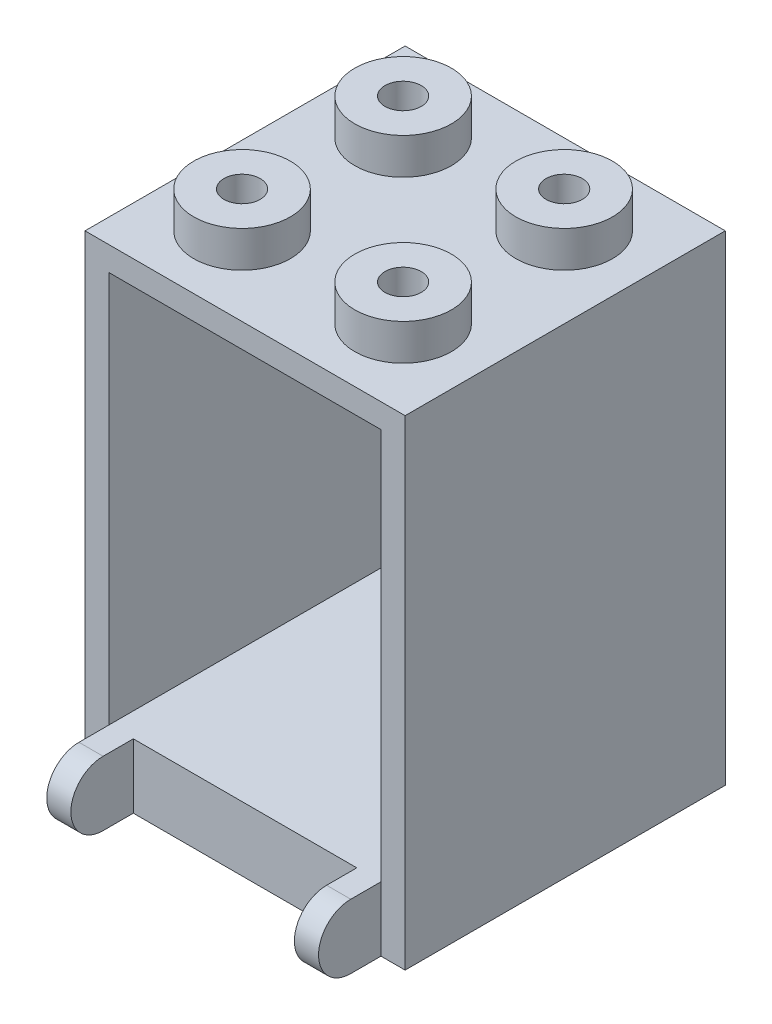
from build123d import *

# Parameters (mm, degrees)
SKETCH1_W            = 15.9
SKETCH1_H            = 23.85
BOSS_EXTRUDE1_DEPTH  = 15.9
SHELL2_T             = -1.2
SKETCH7_W            = 13.5
SKETCH7_H            = 14.7
BOSS_EXTRUDE4_DEPTH  = 2
SHELL3_START         = -6.75
SHELL3_OUTLINE_W     = 2
SHELL3_OUTLINE_H     = 13.5
SHELL3_DEPTH         = 13.5
BOSS_EXTRUDE3_DEPTH  = 1.2
SKETCH8_W            = 8.5
SKETCH8_H            = 2.8
CUT_EXTRUDE2_DEPTH   = 23.852748741
SKETCH9_W            = 0.5
SKETCH9_H            = 1.4
BOSS_EXTRUDE5_DEPTH  = 12.7
SKETCH10_R           = 3.25
SKETCH10_R_2         = 2.4
BOSS_EXTRUDE6_DEPTH  = 2
SKETCH11_R           = 2.4
SKETCH11_R_2         = 0.9
BOSS_EXTRUDE7_DEPTH  = 1.8
LPATTERN1_COUNT      = 2
LPATTERN1_PITCH      = 8
LPATTERN1_COUNT_DIR2 = 2
LPATTERN1_PITCH_DIR2 = 8


# Read off the part's stored shape, not the designer's step: Shell3
with BuildPart() as part:
    # Sketch1 → Boss-Extrude1 (new body)
    with BuildSketch(Plane.XY):
        Rectangle(SKETCH1_W, SKETCH1_H)
    extrude(amount=-BOSS_EXTRUDE1_DEPTH)

    # Shell2
    shell2_openings = [part.faces().sort_by_distance(p)[0] for p in [
        (0, 0, 0),
    ]]
    offset(amount=SHELL2_T, openings=shell2_openings, kind=Kind.INTERSECTION)

    # Sketch7 → Boss-Extrude4 (add)
    with BuildSketch(Plane(origin=(0, -10.725, 0), x_dir=(1, 0, 0), z_dir=(0, 1, 0))):
        with Locations((0, 7.35)):
            Rectangle(SKETCH7_W, SKETCH7_H)
    extrude(amount=BOSS_EXTRUDE4_DEPTH)

    # Shell3 outline → Shell3 (cut)
    with BuildSketch(Plane.YZ.offset(SHELL3_START)):
        with Locations((-10.925, -7.95)):
            Rectangle(SHELL3_OUTLINE_W, SHELL3_OUTLINE_H)
    extrude(amount=SHELL3_DEPTH, mode=Mode.SUBTRACT)

    # Sketch5 → Boss-Extrude3 (add)
    with BuildSketch(Plane(origin=(6.75, 0, 0), x_dir=(0, 0, -1), z_dir=(1, 0, 0))):
        with BuildLine():
            Line((0, -11.925), (-1.5, -11.925))
            ThreePointArc((-1.5, -11.925), (-3.1, -10.325), (-1.5, -8.725))
            Line((-1.5, -8.725), (0, -8.725))
            Line((0, -8.725), (0, -11.925))
        make_face()
    boss_extrude3 = extrude(amount=-BOSS_EXTRUDE3_DEPTH)

    # Mirror2: Boss-Extrude3 across plane
    add(boss_extrude3.mirror(Plane(origin=(0, 0, 0), x_dir=(0, 0, 1), z_dir=(1, 0, 0))))

    # Sketch8 → Cut-Extrude2 (cut, through all)
    with BuildSketch(Plane.XY.offset(-14.7)):
        with Locations((0, 9.325)):
            Rectangle(SKETCH8_W, SKETCH8_H)
    extrude(amount=-CUT_EXTRUDE2_DEPTH, mode=Mode.SUBTRACT)

    # Sketch9 → Boss-Extrude5 (add)
    with BuildSketch(Plane.XY.offset(-14.7)):
        with Locations((-4.5, 10.025)):
            Rectangle(SKETCH9_W, SKETCH9_H)
    boss_extrude5 = extrude(amount=BOSS_EXTRUDE5_DEPTH)

    # Mirror3: Boss-Extrude5 across plane
    add(boss_extrude5.mirror(Plane(origin=(0, 0, 0), x_dir=(0, 0, 1), z_dir=(1, 0, 0))))

    # Sketch10 → Boss-Extrude6 (add)
    with BuildSketch(Plane.XZ.offset(9.925)):
        with Locations(Location((0, -7.95, 0), (0, 0, 90))):
            Circle(SKETCH10_R)
        with Locations(Location((0, -7.95, 0), (0, 0, 270))):
            Circle(SKETCH10_R_2, mode=Mode.SUBTRACT)
    extrude(amount=BOSS_EXTRUDE6_DEPTH)

    # Sketch11 → Boss-Extrude7 (add)
    with BuildSketch(Plane(origin=(0, 11.925, 0), x_dir=(1, 0, 0), z_dir=(0, 1, 0))):
        with Locations(Location((-4.05, 3.9, 0), (0, 0, 270))):
            Circle(SKETCH11_R)
        with Locations(Location((-4.05, 3.9, 0), (0, 0, 270))):
            Circle(SKETCH11_R_2, mode=Mode.SUBTRACT)
    boss_extrude7 = extrude(amount=BOSS_EXTRUDE7_DEPTH)

    # LPattern1: Boss-Extrude7 2 × 2
    with Locations(*[(i * LPATTERN1_PITCH, 0, -j * LPATTERN1_PITCH_DIR2) for i in range(LPATTERN1_COUNT) for j in range(LPATTERN1_COUNT_DIR2) if (i, j) != (0, 0)]):
        add(boss_extrude7)


solid = part.part
